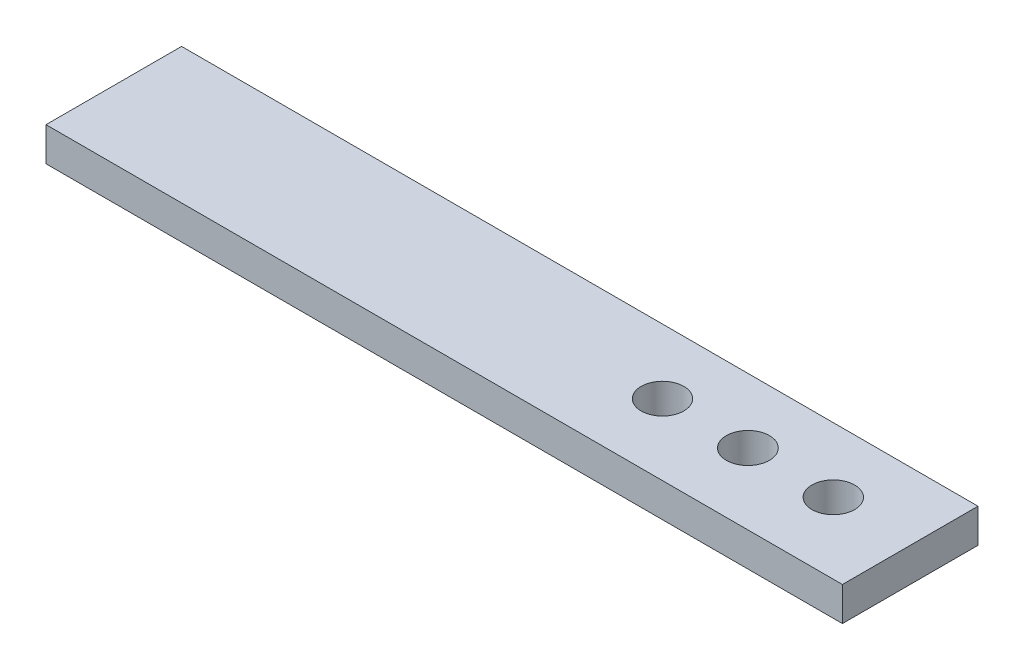
from build123d import *

# Parameters (mm, degrees)
SKETCH1_W           = 100
SKETCH1_H           = 12.7
SKETCH1_R           = 2
SKETCH1_R_2         = 2.014884623
BOSS_EXTRUDE1_DEPTH = 3.175
SKETCH3_W           = 30.027817339
SKETCH3_H           = 17.278580048
CUT_EXTRUDE1_DEPTH  = 25.4


with BuildPart() as part:
    # Sketch1 → Boss-Extrude1 (new body)
    with BuildSketch(Plane(origin=(0, 0, 0), x_dir=(1, 0, 0), z_dir=(0, 1, 0))):
        with Locations((50, 6.35)):
            Rectangle(SKETCH1_W, SKETCH1_H)
        with Locations((92.500362967, 6.645925942)):
            Circle(SKETCH1_R, mode=Mode.SUBTRACT)
        with Locations((84.500362967, 6.645925942)):
            Circle(SKETCH1_R_2, mode=Mode.SUBTRACT)
        with Locations((76.500362967, 6.645925942)):
            Circle(SKETCH1_R, mode=Mode.SUBTRACT)
    extrude(amount=BOSS_EXTRUDE1_DEPTH)

    # Sketch3 → Cut-Extrude1 (cut)
    with BuildSketch(Plane.ZY):
        with Locations((-4.12733164, -0.51670632)):
            Rectangle(SKETCH3_W, SKETCH3_H)
    extrude(amount=-CUT_EXTRUDE1_DEPTH, mode=Mode.SUBTRACT)


solid = part.part
